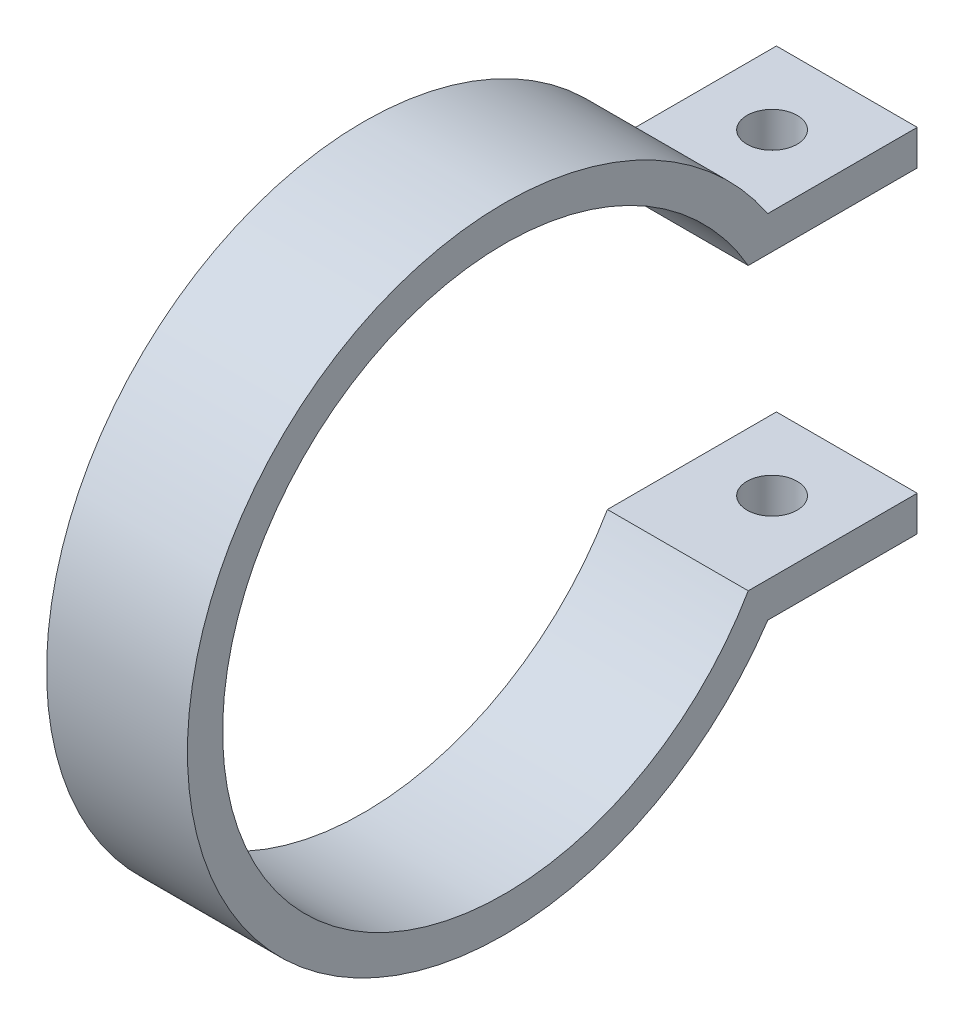
from build123d import *

# Parameters (mm, degrees)
BOSS_EXTRUDE1_DEPTH       = 6.35
TAP_DRILL_FOR_4_40_TAP1_D = 2.2606


with BuildPart() as part:
    # Sketch2 → Boss-Extrude1 (new body)
    with BuildSketch(Plane.YZ):
        with BuildLine():
            Line((-6.35, -10.998522628), (-6.35, -18.618522628))
            Line((-6.35, -18.618522628), (-7.9375, -18.618522628))
            Line((-7.9375, -18.618522628), (-7.9375, -11.879762203))
            ThreePointArc((-7.9375, -11.879762203), (0, 14.2875), (7.9375, -11.879762203))
            Line((7.9375, -11.879762203), (7.9375, -18.618522628))
            Line((7.9375, -18.618522628), (6.35, -18.618522628))
            Line((6.35, -18.618522628), (6.35, -10.998522628))
            ThreePointArc((6.35, -10.998522628), (0, 12.7), (-6.35, -10.998522628))
        make_face()
    extrude(amount=BOSS_EXTRUDE1_DEPTH)

    # Tap Drill for #4-40 Tap1 (through all)
    with Locations(Plane.XZ.offset(7.9375)):
        with Locations((3.175, -15.249142416)):
            Hole(TAP_DRILL_FOR_4_40_TAP1_D / 2)


solid = part.part
